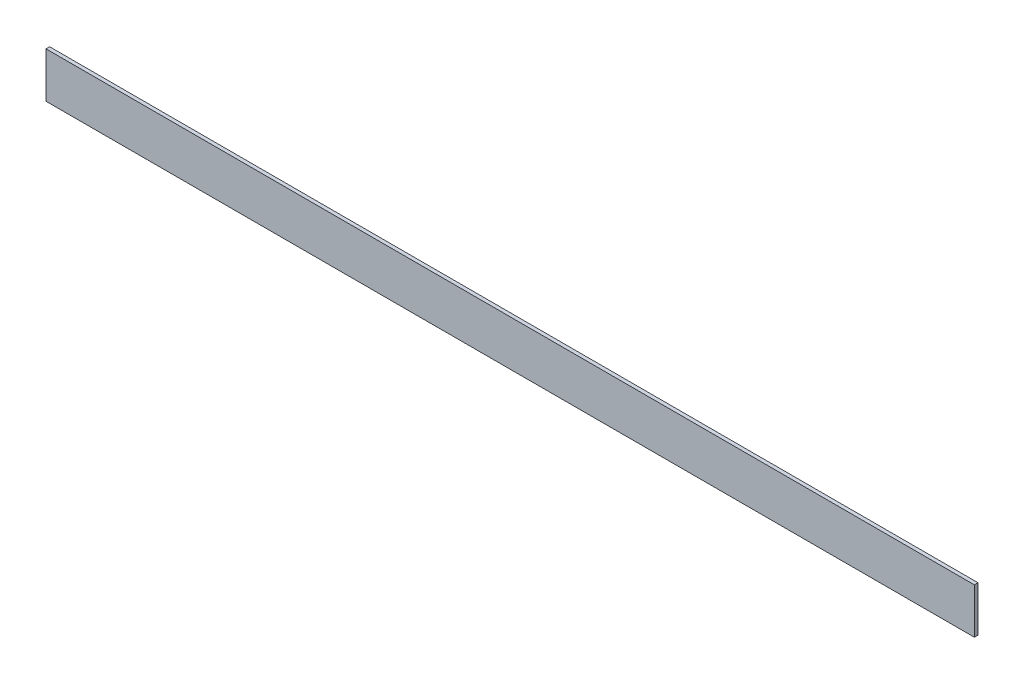
from build123d import *

# Parameters (mm, degrees)
EXTRUDE_1_DEPTH     = 511
SKETCH_2_W          = 23
SKETCH_2_H          = 23
CUT_EXTRUDE_1_DEPTH = 513.221631718


with BuildPart() as part:
    # Эскиз1 → Вытянуть-Тонкостенный1 (new body)
    with BuildSketch(Plane(origin=(0, 0, 0), x_dir=(0, 0, -1), z_dir=(1, 0, 0))):
        Polygon((0, 25), (0, 0), (25, 0), (25, 2), (2, 2), (2, 25), align=None)
    extrude(amount=EXTRUDE_1_DEPTH)

    # Эскиз2 → Вырез-Вытянуть1 (cut, through all)
    with BuildSketch(Plane.XZ):
        with Locations((11.5, -13.5)):
            Rectangle(SKETCH_2_W, SKETCH_2_H)
        with Locations((499.5, -13.5)):
            Rectangle(SKETCH_2_W, SKETCH_2_H)
    extrude(amount=-CUT_EXTRUDE_1_DEPTH, mode=Mode.SUBTRACT)


solid = part.part
